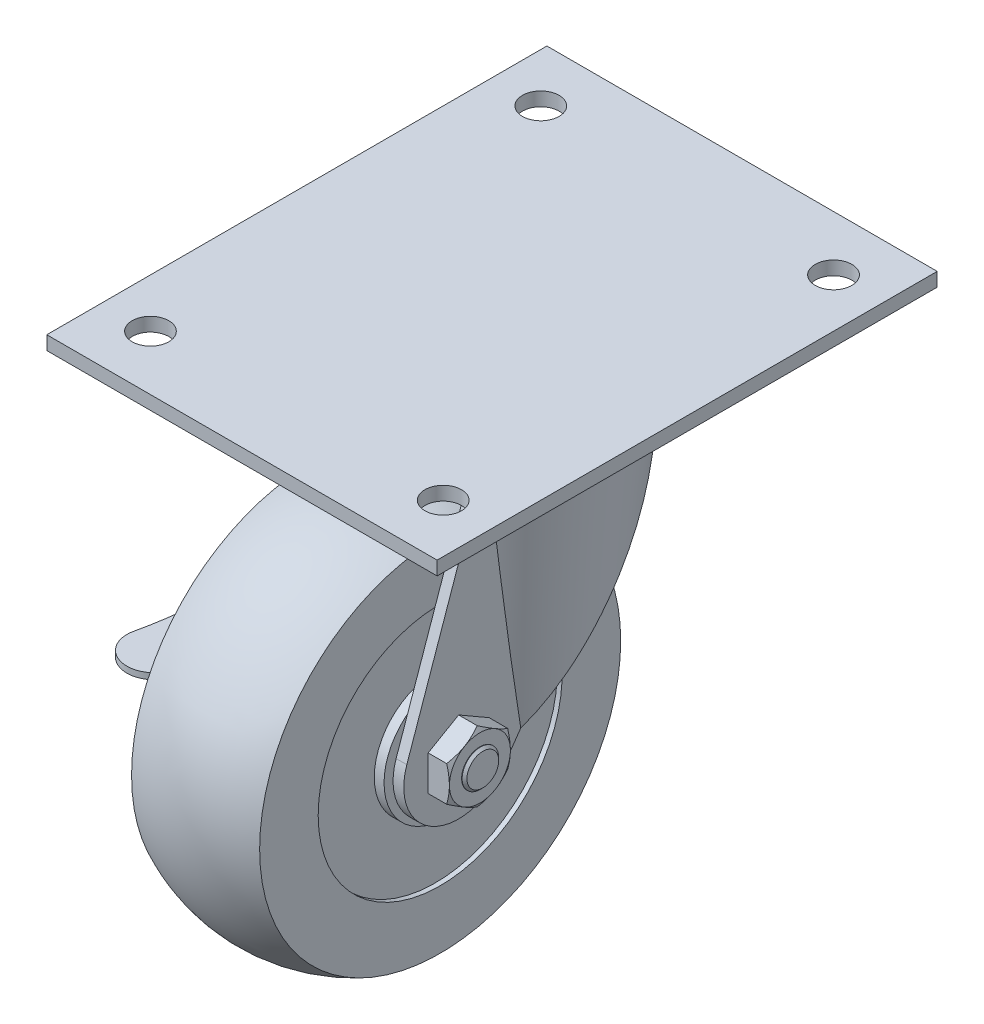
from build123d import *
from OCP.BRepAlgoAPI import BRepAlgoAPI_Cut
from OCP.TopTools import TopTools_ListOfShape

# Parameters (mm, degrees)
SKETCH3_W                   = 101.6
SKETCH3_H                   = 130.175
SKETCH3_R                   = 4.7625
EXTRUDE1_DEPTH              = 3.571875
SKETCH9_R                   = 31.3928125
EXTRUDE7_DEPTH              = 3.9624
FILLET2_R                   = 1.778
SKETCH4_R                   = 31.3928125
EXTRUDE2_DEPTH              = 4.7625
FILLET3_R                   = 1.778
SKETCH14_R                  = 31.3928125
EXTRUDE13_DEPTH             = 78.190725
EXTRUDE13_TAPER             = 5
EXTRUDE13_OTHER_WAY_DEPTH   = 5.08
EXTRUDE14_DEPTH             = 21.478875
SHELL1_START                = 59.5376
SHELL1_DEPTH                = 6.6675
SHELL1_START_2              = -18.70075
SHELL1_4_DEPTH              = 37.4015
SKETCH44_R                  = 61.958083024
CUT_EXTRUDE4_DEPTH          = 5.08
CUT_EXTRUDE1_DEPTH          = 133.134940496
CUT_EXTRUDE1_DEPTH_BACK     = 133.134940496
SKETCH45_W                  = 37.4015
SKETCH45_H                  = 10.116972476
CUT_EXTRUDE5_DEPTH          = 2.778125
EXTRUDE27_REACH             = 134.135
SKETCH23_R                  = 4.7625
EXTRUDE27_DIRECTION_2_REACH = 134.135
EXTRUDE28_DEPTH             = 5.5372
SKETCH37_OUTSIDE_W          = 696.444
SKETCH37_OUTSIDE_H          = 677.394
SKETCH37_OUTSIDE_R          = 7.9375
EXTRUDE42_DEPTH             = 145.687055497
EXTRUDE42_DRAFT             = -60
SKETCH25_R                  = 4.7625
EXTRUDE29_DEPTH             = 0.762
CHAMFER1_SIZE               = 0.635
EXTRUDE33_DEPTH             = 14.2875
EXTRUDE35_START             = -1.5875
EXTRUDE35_DEPTH             = 7.137398261
BOSS_EXTRUDE1_DEPTH         = 6.102325924
EXTRUDE36_DEPTH             = 1.5875
BOSS_EXTRUDE2_DEPTH         = 4.514826
BOSS_EXTRUDE3_DEPTH         = 1.5875
FILLET4_R                   = 1.5875
EXTRUDE37_DEPTH             = 4.7625
SKETCH34_OUTSIDE_W          = 697.962
SKETCH34_OUTSIDE_H          = 678.912
SKETCH34_OUTSIDE_R          = 7.9375
EXTRUDE38_DEPTH             = 146.125816049
EXTRUDE38_DRAFT             = -60


with BuildPart() as part:
    # Sketch1 → Revolve1 (revolve)
    with BuildSketch(Plane.XY, mode=Mode.PRIVATE) as revolve1_sk:
        with BuildLine():
            Line((-17.93875, 0), (-17.93875, 15.875))
            Line((-17.93875, 15.875), (-15.39875, 15.875))
            Line((-15.39875, 15.875), (-15.39875, 31.75))
            Line((-15.39875, 31.75), (-16.66875, 31.75))
            Line((-16.66875, 31.75), (-16.66875, 46.99))
            ThreePointArc((-16.66875, 46.99), (0, 50.8), (16.66875, 46.99))
            Line((16.66875, 46.99), (16.66875, 31.75))
            Line((16.66875, 31.75), (15.39875, 31.75))
            Line((15.39875, 31.75), (15.39875, 15.875))
            Line((15.39875, 15.875), (17.93875, 15.875))
            Line((17.93875, 15.875), (17.93875, 0))
            Line((17.93875, 0), (-17.93875, 0))
        make_face()
    revolve(revolve1_sk.sketch.rotate(Axis((-37.852772957, 0, 0), (1, 0, 0)), 90), axis=Axis((-37.852772957, 0, 0), (1, 0, 0)))


with BuildPart() as body_2:
    # Sketch3 → Extrude1 (new body)
    with BuildSketch(Plane(origin=(0, 76.2, 0), x_dir=(-1, 0, 0), z_dir=(0, 1, 0))):
        with Locations((0, -30.1625)):
            Rectangle(SKETCH3_W, SKETCH3_H)
        with Locations(Location((38.1, 20.6375, 0), (0, 0, 90))):
            Circle(SKETCH3_R, mode=Mode.SUBTRACT)
        with Locations(Location((38.1, -80.9625, 0), (0, 0, 90))):
            Circle(SKETCH3_R, mode=Mode.SUBTRACT)
        with Locations(Location((-38.1, 20.6375, 0), (0, 0, 90))):
            Circle(SKETCH3_R, mode=Mode.SUBTRACT)
        with Locations(Location((-38.1, -80.9625, 0), (0, 0, 90))):
            Circle(SKETCH3_R, mode=Mode.SUBTRACT)
    extrude(amount=-EXTRUDE1_DEPTH)

    # Sketch9 → Extrude7 (add)
    with BuildSketch(Plane.XZ.offset(-72.628125)):
        with Locations(Location((0, -30.1625, 0), (0, 0, 270))):
            Circle(SKETCH9_R)
    extrude(amount=EXTRUDE7_DEPTH)

    # Fillet2
    fillet2_edges = [body_2.edges().sort_by_distance(p)[0] for p in [
        (0, 68.665725, 1.2303125),
    ]]
    fillet(fillet2_edges, radius=FILLET2_R)


with BuildPart() as body_3:
    # Sketch4 → Extrude2 (new body)
    with BuildSketch(Plane(origin=(0, 68.665725, 0), x_dir=(-1, 0, 0), z_dir=(0, 1, 0))):
        with Locations(Location((0, -30.1625, 0), (0, 0, 270))):
            Circle(SKETCH4_R)
    extrude(amount=-EXTRUDE2_DEPTH)

    # Fillet3
    fillet3_edges = [body_3.edges().sort_by_distance(p)[0] for p in [
        (0, 68.665725, 1.2303125),
    ]]
    fillet(fillet3_edges, radius=FILLET3_R)


with BuildPart() as body_4:
    # Sketch14 → Extrude13 (new body)
    with BuildSketch(Plane.XZ.offset(-63.903225)):
        with Locations(Location((0, -30.1625, 0), (0, 0, 270))):
            Circle(SKETCH14_R)
    extrude(amount=EXTRUDE13_DEPTH, taper=EXTRUDE13_TAPER)

    # Sketch14 → Extrude13 other way (add)
    with BuildSketch(Plane.XZ.offset(-63.903225)):
        with Locations(Location((0, -30.1625, 0), (0, 0, 270))):
            Circle(SKETCH14_R)
    extrude(amount=-EXTRUDE13_OTHER_WAY_DEPTH)

    # Sketch15 → Extrude14 (add, symmetric)
    with BuildSketch(Plane(origin=(0, 0, 0), x_dir=(0, 0, -1), z_dir=(1, 0, 0))):
        Polygon((-33.943962099, -17.065625), (30.1625, -17.065625), (30.1625, 62.315725), (-6.3103125, 62.315725), align=None)
    extrude(amount=EXTRUDE14_DEPTH, both=True)

    # Shell1: read off the stored shape, not the designer's step
    # Shell1 outline → Shell1 (cut)
    with BuildSketch(Plane(origin=(0, 0, 0), x_dir=(1, 0, 0), z_dir=(0, 1, 0)).offset(SHELL1_START)):
        with BuildLine():
            ThreePointArc((18.70075, 8.504192352), (0, 58.7771875), (-18.70075, 8.504192352))
            ThreePointArc((-18.70075, 8.504192352), (0, 1.5478125), (18.70075, 8.504192352))
        make_face()
    extrude(amount=SHELL1_DEPTH, mode=Mode.SUBTRACT)

    # Shell1 2 outline → Shell1 2 (revolve, cut)
    with BuildSketch(Plane.XY.offset(-30.1625)):
        Polygon((0, 59.5376), (0, -14.2875), (21.763273483, -14.2875), (28.222132817, 59.5376), align=None)
    revolve(axis=Axis((0, 0, -30.1625), (0, 1, 0)), mode=Mode.SUBTRACT)

    # Shell1 3 outline → Shell1 3 (revolve)
    with BuildSketch(Plane.XY.offset(-30.1625)):
        Polygon((28.6146875, 64.024520557), (28.222132817, 59.5376), (28.6146875, 59.5376), align=None)
    revolve(axis=Axis((0, 0, -30.1625), (0, 1, 0)))

    # Shell1 4 outline → Shell1 4 (cut)
    with BuildSketch(Plane.YZ.offset(SHELL1_START_2)):
        Polygon((59.5376, 4.335770191), (-14.2875, 30.035219054), (-14.2875, -21), (59.5376, -21), align=None)
    extrude(amount=SHELL1_4_DEPTH, mode=Mode.SUBTRACT)

    # Sketch44 → Cut-Extrude4 (cut)
    with BuildSketch(Plane(origin=(0, 68.983225, 0), x_dir=(1, 0, 0), z_dir=(0, 1, 0))):
        with Locations((0, 30.1625)):
            Circle(SKETCH44_R)
    extrude(amount=-CUT_EXTRUDE4_DEPTH, mode=Mode.SUBTRACT)

    # Sketch41 → Cut-Extrude1 (cut, two sides: drawn at the far end of the back side and taken through both)
    with BuildSketch(Plane(origin=(0, 0, 0), x_dir=(0, 0, -1), z_dir=(1, 0, 0)).offset(-CUT_EXTRUDE1_DEPTH_BACK)):
        with BuildLine():
            Line((11.666248345, -8.248109226), (61.396810357, 62.091537211))
            Line((61.396810357, 62.091537211), (54.471456026, -17.065625))
            Line((54.471456026, -17.065625), (-33.943962099, -17.065625))
            Line((-33.943962099, -17.065625), (-33.943962099, 62.315725))
            Line((-33.943962099, 62.315725), (6.564442144, 62.315725))
            Line((6.564442144, 62.315725), (-13.493297895, 4.697187261))
            ThreePointArc((-13.493297895, 4.697187261), (-6.536796065, -12.704446208), (11.666248345, -8.248109226))
        make_face()
    extrude(amount=CUT_EXTRUDE1_DEPTH + CUT_EXTRUDE1_DEPTH_BACK, mode=Mode.SUBTRACT)

    # Sketch45 → Cut-Extrude5 (cut)
    with BuildSketch(Plane.XZ.offset(-59.5376)):
        with Locations((0, -3.967061991)):
            Rectangle(SKETCH45_W, SKETCH45_H)
    extrude(amount=-CUT_EXTRUDE5_DEPTH, mode=Mode.SUBTRACT)


with BuildPart() as body_5:

    # Extrude27: up to this face of the body (flat: up to its plane)
    extrude27_end = Plane(body_4.part.faces().sort_by_distance((21.478875, 14.443558801, -2.006371397))[0])
    # Sketch23 → Extrude27 (new, up to the picked face)
    with BuildSketch(Plane(origin=(0, 0, 0), x_dir=(0, 0, -1), z_dir=(1, 0, 0)), mode=Mode.PRIVATE) as extrude27_sk1:
        Circle(SKETCH23_R)
    extrude27_tool1 = split(extrude(extrude27_sk1.sketch, amount=EXTRUDE27_REACH, mode=Mode.PRIVATE), bisect_by=extrude27_end, keep=Keep.BOTH, mode=Mode.PRIVATE)
    add(extrude27_tool1.solids().sort_by(Axis((0, 0, 0), (1, 0, 0)))[0])


    # Extrude27 direction 2: up to this face of the body (flat: up to its plane)
    extrude27_direction_2_end = Plane(body_4.part.faces().sort_by_distance((-21.478875, 14.443558801, -2.006371397))[0])
    # Sketch23 → Extrude27 direction 2 (add, up to the picked face)
    with BuildSketch(Plane(origin=(0, 0, 0), x_dir=(0, 0, -1), z_dir=(1, 0, 0)), mode=Mode.PRIVATE) as extrude27_direction_2_sk1:
        Circle(SKETCH23_R)
    extrude27_direction_2_tool1 = split(extrude(extrude27_direction_2_sk1.sketch, amount=-EXTRUDE27_DIRECTION_2_REACH, mode=Mode.PRIVATE), bisect_by=extrude27_direction_2_end, keep=Keep.BOTH, mode=Mode.PRIVATE)
    add(extrude27_direction_2_tool1.solids().sort_by(Axis((0, 0, 0), (-1, 0, 0)))[0])


with BuildPart() as body_6:
    # Sketch24 → Extrude28 (new body)
    with BuildSketch(Plane(origin=(21.478875, 0, 0), x_dir=(0, 0, -1), z_dir=(1, 0, 0))):
        Polygon((0, 9.165435523), (-7.9375, 4.582717762), (-7.9375, -4.582717762), (0, -9.165435523), (7.9375, -4.582717762), (7.9375, 4.582717762), align=None)
    extrude(amount=EXTRUDE28_DEPTH)


with BuildPart() as extrude42_tool:
    # Sketch37 outside → Extrude42 (with draft: the straight prism first)
    with BuildSketch(Plane(origin=(27.016075, 0, 0), x_dir=(0, 0, -1), z_dir=(1, 0, 0))):
        with Locations((22.225, 12.7)):
            Rectangle(SKETCH37_OUTSIDE_W, SKETCH37_OUTSIDE_H)
        Circle(SKETCH37_OUTSIDE_R, mode=Mode.SUBTRACT)
    extrude(amount=-EXTRUDE42_DEPTH)
    # Extrude42: the draft: its side faces are tilted about the plane it starts from
    extrude42_sides = [extrude42_tool.faces().sort_by_distance(p)[0] for p in [
        (-45.827452749, -325.997, -22.225),
        (-45.827452749, 12.7, -370.447),
        (-45.827452749, 351.397, -22.225),
        (-45.827452749, 12.7, 325.997),
        (-45.827452749, 0, 7.9375),
    ]]
    draft(extrude42_sides, Plane(origin=(27.016075, 0, 0), x_dir=(0, 0, -1), z_dir=(1, 0, 0)), EXTRUDE42_DRAFT)


with BuildPart() as body_6_1:
    add(body_6.part)

    # Extrude42: cut by extrude42_tool
    add(extrude42_tool.part, mode=Mode.SUBTRACT)


with BuildPart() as body_7:
    # Mirror1: mirrored copy
    add(body_6_1.part.mirror(Plane(origin=(0, 0, 0), x_dir=(0, 0, 1), z_dir=(1, 0, 0))))


with BuildPart() as body_8:
    # Sketch25 → Extrude29 (new body)
    with BuildSketch(Plane(origin=(27.016075, 0, 0), x_dir=(0, 0, -1), z_dir=(1, 0, 0))):
        Circle(SKETCH25_R)
    extrude(amount=EXTRUDE29_DEPTH)

    # Chamfer1
    chamfer1_edges = [body_8.edges().sort_by_distance(p)[0] for p in [
        (27.778075, 0, 4.7625),
    ]]
    chamfer(chamfer1_edges, length=CHAMFER1_SIZE)

    # Combine4: union body 7, body 6, body 5, body 4, body 3, body 2
    add(body_7.part)
    add(body_6_1.part)
    add(body_5.part)
    add(body_4.part)
    add(body_3.part)
    add(body_2.part)


with BuildPart() as body_9:
    # Sketch30 → Extrude33 (new body)
    with BuildSketch(Plane.ZY.offset(27.581200924)):
        with BuildLine():
            Line((10.496002572, 7.1501), (30.1625, 7.1501))
            Line((30.1625, 7.1501), (30.1625, 5.5626))
            Line((30.1625, 5.5626), (9.620038331, 5.5626))
            ThreePointArc((9.620038331, 5.5626), (0, 11.1125), (-9.620038331, 5.5626))
            Line((-9.620038331, 5.5626), (-30.1625, 5.5626))
            Line((-30.1625, 5.5626), (-30.1625, 7.1501))
            Line((-30.1625, 7.1501), (-10.496002572, 7.1501))
            ThreePointArc((-10.496002572, 7.1501), (0, 12.7), (10.496002572, 7.1501))
        make_face()
    extrude(amount=EXTRUDE33_DEPTH)


with BuildPart() as extrude35_tool:
    # Extrude35: read off the stored shape, not the designer's step
    # Extrude35 outline → Extrude35 (new body)
    with BuildSketch(Plane(origin=(0, 7.1501, 0), x_dir=(1, 0, 0), z_dir=(0, 1, 0)).offset(EXTRUDE35_START)):
        with BuildLine():
            ThreePointArc((-41.868700924, -23.018750119), (-41.825603021, -22.235229828), (-41.696829301, -21.46116342))
            ThreePointArc((-41.696829301, -21.46116342), (-39.328700924, 0), (-41.696829301, 21.46116342))
            ThreePointArc((-41.696829301, 21.46116342), (-41.825603014, 22.235229769), (-41.868700924, 23.018750001))
            Line((-41.868700924, 23.018750001), (-41.868700924, -23.018750119))
        make_face()
        with BuildLine():
            ThreePointArc((-34.724950924, -30.1625), (-39.77634495, -28.07014411), (-41.868700924, -23.018750119))
            Line((-41.868700924, -23.018750119), (-41.868700924, -30.1625))
            Line((-41.868700924, -30.1625), (-34.724950924, -30.1625))
        make_face()
        with BuildLine():
            Line((-41.868700924, 30.1625), (-41.868700924, 23.018750001))
            ThreePointArc((-41.868700924, 23.018750001), (-39.776344992, 28.070144069), (-34.724950924, 30.1625))
            Line((-34.724950924, 30.1625), (-41.868700924, 30.1625))
        make_face()
        with BuildLine():
            ThreePointArc((-27.581200924, -23.01875), (-29.673556856, -28.070144068), (-34.724950924, -30.1625))
            Line((-34.724950924, -30.1625), (-27.581200924, -30.1625))
            Line((-27.581200924, -30.1625), (-27.581200924, -23.01875))
        make_face()
        with BuildLine():
            Line((-27.581200924, 30.1625), (-34.724950924, 30.1625))
            ThreePointArc((-34.724950924, 30.1625), (-29.673556856, 28.070144068), (-27.581200924, 23.01875))
            Line((-27.581200924, 23.01875), (-27.581200924, 30.1625))
        make_face()
    extrude(amount=EXTRUDE35_DEPTH)


with BuildPart() as body_9_1:
    add(body_9.part)

    # Extrude35: cut by extrude35_tool, with a tolerance
    extrude35_stock = TopTools_ListOfShape()
    extrude35_stock.Append(body_9_1.part.wrapped)
    extrude35_tools = TopTools_ListOfShape()
    extrude35_tools.Append(extrude35_tool.part.wrapped)
    extrude35_cut = BRepAlgoAPI_Cut()
    extrude35_cut.SetArguments(extrude35_stock)
    extrude35_cut.SetTools(extrude35_tools)
    extrude35_cut.SetFuzzyValue(0.00001)
    extrude35_cut.Build()
    add(Compound.cast(extrude35_cut.Shape()).solids(), mode=Mode.REPLACE)

    # Sketch47 → Boss-Extrude1 (add)
    with BuildSketch(Plane(origin=(-27.581200924, 0, 0), x_dir=(0, 0, -1), z_dir=(1, 0, 0))):
        with BuildLine():
            Line((9.620038331, 5.5626), (11.416982142, 5.5626))
            ThreePointArc((11.416982142, 5.5626), (0, 12.7), (-11.416982142, 5.5626))
            Line((-11.416982142, 5.5626), (-9.620038331, 5.5626))
            ThreePointArc((-9.620038331, 5.5626), (0, 11.1125), (9.620038331, 5.5626))
        make_face()
    extrude(amount=BOSS_EXTRUDE1_DEPTH)

    # Sketch32 → Extrude36 (add)
    with BuildSketch(Plane(origin=(-21.478875, 0, 0), x_dir=(0, 0, -1), z_dir=(1, 0, 0))):
        with BuildLine():
            Line((-15.199155336, 7.1501), (15.199155336, 7.1501))
            Line((15.199155336, 7.1501), (15.199155336, -4.582717762))
            Line((15.199155336, -4.582717762), (7.527754889, -10.228533929))
            ThreePointArc((7.527754889, -10.228533929), (0, -12.7), (-7.527754889, -10.228533929))
            Line((-7.527754889, -10.228533929), (-15.199155336, -4.582717762))
            Line((-15.199155336, -4.582717762), (-15.199155336, 7.1501))
        make_face()
    extrude(amount=-EXTRUDE36_DEPTH)



with BuildPart() as body_10:
    # Sketch48 → Boss-Extrude2 (new body)
    with BuildSketch(Plane.ZY.offset(23.066375)):
        with BuildLine():
            Line((-15.199155336, 7.1501), (-10.496002572, 7.1501))
            ThreePointArc((-10.496002572, 7.1501), (0, 12.7), (10.496002572, 7.1501))
            Line((10.496002572, 7.1501), (15.199155336, 7.1501))
            Line((15.199155336, 7.1501), (15.199155336, 5.5626))
            Line((15.199155336, 5.5626), (9.620038331, 5.5626))
            ThreePointArc((9.620038331, 5.5626), (0, 11.1125), (-9.620038331, 5.5626))
            Line((-9.620038331, 5.5626), (-15.199155336, 5.5626))
            Line((-15.199155336, 5.5626), (-15.199155336, 7.1501))
        make_face()
    extrude(amount=BOSS_EXTRUDE2_DEPTH)


with BuildPart() as body_9_2:
    add(body_9_1.part)

    add(body_10.part)  # Boss-Extrude3 merges body 10
    # Sketch49 → Boss-Extrude3 (add)
    with BuildSketch(Plane(origin=(-21.478875, 0, 0), x_dir=(0, 0, -1), z_dir=(1, 0, 0))):
        with BuildLine():
            Line((8.506687148, 7.1501), (-8.506687148, 7.1501))
            ThreePointArc((-8.506687148, 7.1501), (0, 11.1125), (8.506687148, 7.1501))
        make_face()
    extrude(amount=-BOSS_EXTRUDE3_DEPTH)

    # Fillet4
    fillet4_edges = [body_9_2.edges().sort_by_distance(p)[0] for p in [
        (-23.066375, 5.5626, -12.409596833),
        (-23.066375, 11.1125, 0),
        (-23.066375, 5.5626, 12.409596833),
    ]]
    fillet(fillet4_edges, radius=FILLET4_R)


with BuildPart() as body_10_2:
    # Sketch33 → Extrude37 (new body)
    with BuildSketch(Plane.ZY.offset(23.066375)):
        Polygon((0, -9.165435523), (7.9375, -4.582717762), (7.9375, 4.582717762), (0, 9.165435523), (-7.9375, 4.582717762), (-7.9375, -4.582717762), align=None)
    extrude(amount=EXTRUDE37_DEPTH)


with BuildPart() as extrude38_tool:
    # Sketch34 outside → Extrude38 (with draft: the straight prism first)
    with BuildSketch(Plane.ZY.offset(27.828875)):
        with Locations((-22.225, 12.7)):
            Rectangle(SKETCH34_OUTSIDE_W, SKETCH34_OUTSIDE_H)
        Circle(SKETCH34_OUTSIDE_R, mode=Mode.SUBTRACT)
    extrude(amount=-EXTRUDE38_DEPTH)
    # Extrude38: the draft: its side faces are tilted about the plane it starts from
    extrude38_sides = [extrude38_tool.faces().sort_by_distance(p)[0] for p in [
        (45.234033024, -326.756, -22.225),
        (45.234033024, 12.7, 326.756),
        (45.234033024, 352.156, -22.225),
        (45.234033024, 12.7, -371.206),
        (45.234033024, 0, -7.9375),
    ]]
    draft(extrude38_sides, Plane.ZY.offset(27.828875), EXTRUDE38_DRAFT)


with BuildPart() as body_10_2_1:
    add(body_10_2.part)

    # Extrude38: cut by extrude38_tool
    add(extrude38_tool.part, mode=Mode.SUBTRACT)

    # Combine3: union body 9
    add(body_9_2.part)


solid = Compound([part.part, body_8.part, body_10_2_1.part])
